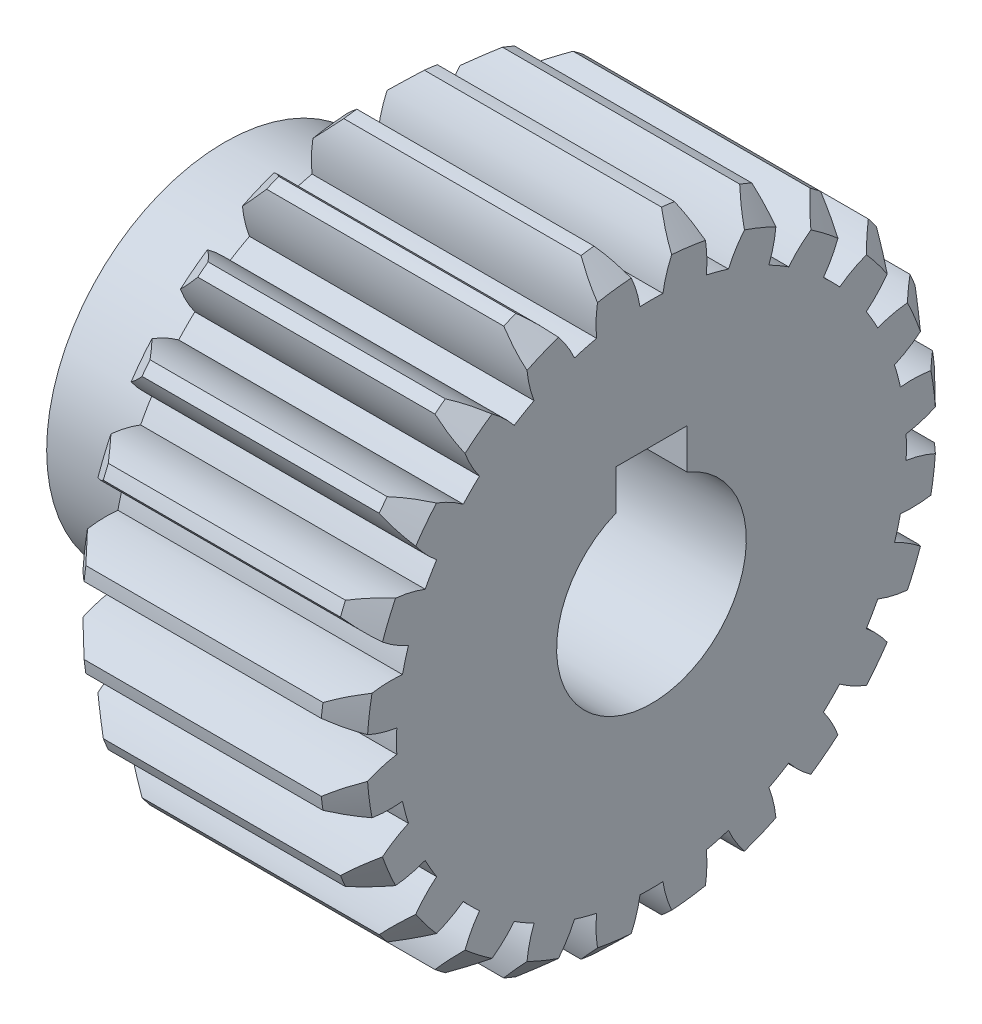
from build123d import *

# Parameters (mm, degrees)
BASPROSKE_W      = 12
BASPROSKE_H      = 13
CHAMFER1_SIZE    = 1
TOOTHCUT_DEPTH   = 22.9544984
TEETHCUTS_COUNT  = 24
TEETHCUTS_ANGLE  = 345
HUBNEAONESKE_R   = 7.5
HUBNEARONE_DEPTH = 6.0019304
BORSKE_R         = 4
BORE_DEPTH       = 18.0019304
KEYSKE_W         = 3
KEYSKE_H         = 5.4
KEYWAY_DEPTH     = 18.0019304


with BuildPart() as part:
    # BasProSke → Base-Revolve (revolve)
    with BuildSketch(Plane(origin=(0, 0, 0), x_dir=(1, 0, 0), z_dir=(0, 1, 0))):
        with Locations((6, 6.5)):
            Rectangle(BASPROSKE_W, BASPROSKE_H)
    revolve(axis=Axis((-10, 0, 0), (1, 0, 0)))

    # Chamfer1
    chamfer1_edges = [part.edges().sort_by_distance(p)[0] for p in [
        (12, 0, 13),
        (0, 0, 13),
    ]]
    chamfer(chamfer1_edges, length=CHAMFER1_SIZE)

    # TooCutSke → ToothCut (cut, through all)
    with BuildSketch(Plane(origin=(0, 0, 0), x_dir=(0, 0, -1), z_dir=(1, 0, 0))):
        with BuildLine():
            ThreePointArc((0.483448384, 10.738122679), (0, 10.749), (-0.483448384, 10.738122679))
            ThreePointArc((-0.483448384, 10.738122679), (-0.821636462, 11.902754369), (-1.44092227, 12.945454344))
            ThreePointArc((-1.44092227, 12.945454344), (0, 13.0254), (1.44092227, 12.945454344))
            ThreePointArc((1.44092227, 12.945454344), (0.821636462, 11.902754369), (0.483448384, 10.738122679))
        make_face()
    toothcut = extrude(amount=TOOTHCUT_DEPTH, mode=Mode.SUBTRACT)

    # TeethCuts: ToothCut ×24 about axis
    teethcuts_axis = Axis((-10, 0, 0), (1, 0, 0))
    for i in range(1, TEETHCUTS_COUNT):
        add(toothcut.rotate(teethcuts_axis, i * TEETHCUTS_ANGLE / (TEETHCUTS_COUNT - 1)), mode=Mode.SUBTRACT)

    # HubNeaOneSke → HubNearOne (add)
    with BuildSketch(Plane.ZY):
        Circle(HUBNEAONESKE_R)
    extrude(amount=HUBNEARONE_DEPTH)

    # BorSke → Bore (cut, symmetric)
    with BuildSketch(Plane(origin=(0, 0, 0), x_dir=(0, 0, -1), z_dir=(1, 0, 0))):
        Circle(BORSKE_R)
    extrude(amount=BORE_DEPTH, both=True, mode=Mode.SUBTRACT)

    # KeySke → Keyway (cut, symmetric)
    with BuildSketch(Plane(origin=(0, 0, 0), x_dir=(0, 0, -1), z_dir=(1, 0, 0))):
        with Locations((0, 2.7)):
            Rectangle(KEYSKE_W, KEYSKE_H)
    extrude(amount=KEYWAY_DEPTH, both=True, mode=Mode.SUBTRACT)


solid = part.part
